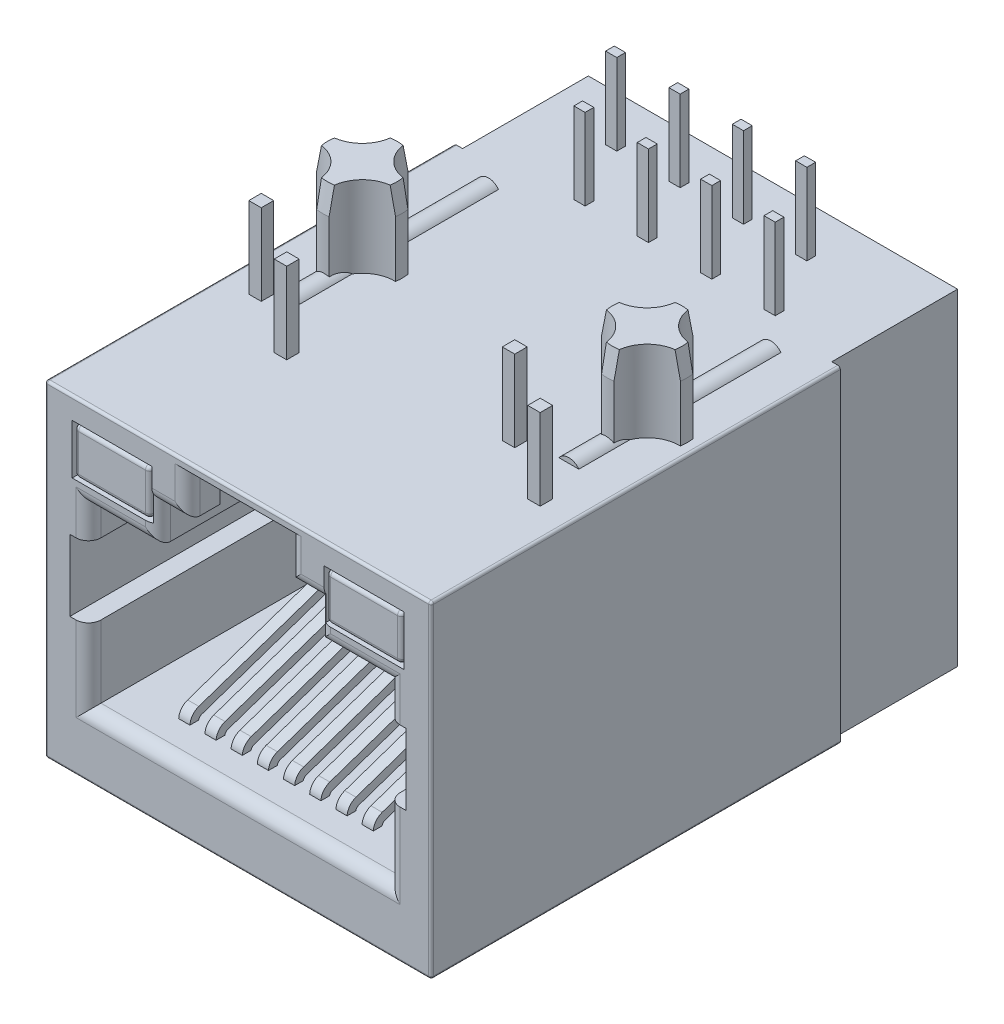
from build123d import *

# Parameters (mm, degrees)
SKETCH1_W            = 15.48
SKETCH1_H            = 13.1
BOSS_EXTRUDE1_DEPTH  = 10.72
SKETCH2_W            = 11.99
SKETCH2_H            = 7.01
CUT_EXTRUDE1_DEPTH   = 12.3
SKETCH4_W            = 6.41
SKETCH4_H            = 3.09
CUT_EXTRUDE3_DEPTH   = 12.3
SKETCH6_W            = 1.18
SKETCH6_H            = 1.61
BOSS_EXTRUDE2_DEPTH  = 1.3
CHAMFER1_SIZE        = 0.2
CHAMFER1_SIZE2       = 1.3
FILLET1_R            = 0.5
BOSS_EXTRUDE3_DEPTH  = 1.3
SKETCH9_W            = 11.99
SKETCH9_H            = 4
BOSS_EXTRUDE4_DEPTH  = 1.3
CHAMFER2_SIZE2       = 0.800078136
CHAMFER2_SIZE        = 1.3
CUT_EXTRUDE4_REACH   = 25.717
SKETCH3_W            = 1.55
SKETCH3_H            = 2.85
SKETCH11_W           = 11.99
SKETCH11_H           = 0.6
CUT_EXTRUDE5_DEPTH   = 1.3
SKETCH10_W           = 0.5
SKETCH10_H           = 3
CUT_EXTRUDE6_DEPTH   = 2.6
LPATTERN1_COUNT      = 8
LPATTERN1_PITCH      = 1.05
BOSS_EXTRUDE5_START  = -3.45
BOSS_EXTRUDE5_DEPTH  = 0.45
LPATTERN2_COUNT      = 8
LPATTERN2_PITCH      = 1.05
FILLET2_R            = 0.53
FILLET3_R            = 0.18
SKETCH13_W           = 3.2
SKETCH13_H           = 2
CUT_EXTRUDE7_DEPTH   = 4
SKETCH14_W           = 3.04
SKETCH14_H           = 1.84
BOSS_EXTRUDE6_DEPTH  = 4
FILLET4_R            = 0.18
FILLET4_OF_MIRROR3_R = 0.18
SKETCH15_R           = 1.6
BOSS_EXTRUDE7_DEPTH  = 3.25
CHAMFER3_SIZE        = 1
CHAMFER3_SIZE2       = 0.2
CUT_EXTRUDE8_REACH   = 23.027
SKETCH16_R           = 1.3
CIRPATTERN1_COUNT    = 4
BOSS_EXTRUDE8_START  = -7.6
BOSS_EXTRUDE8_DEPTH  = 8.1
SKETCH21_W           = 0.34
SKETCH21_H           = 5.04
CUT_EXTRUDE9_DEPTH   = 19.612791301
FILLET5_R            = 0.1
SKETCH22_W           = 0.45
SKETCH22_H           = 0.35
BOSS_EXTRUDE9_DEPTH  = 3.25
LPATTERN3_START      = 6.55
LPATTERN3_OUTLINE_W  = 0.45
LPATTERN3_OUTLINE_H  = 0.35
LPATTERN3_DEPTH      = 3.25
SKETCH23_W           = 0.5
SKETCH23_H           = 0.5
BOSS_EXTRUDE10_DEPTH = 3.25
LPATTERN4_START      = 6.55
LPATTERN4_OUTLINE_W  = 0.5
LPATTERN4_OUTLINE_H  = 0.5
LPATTERN4_DEPTH      = 3.25


# Read off the part's stored shape, not the designer's step: Mirror4, LPattern3, LPattern4
# Some blends are built 0.0001 mm under size
with BuildPart() as part:
    # Sketch1 → Boss-Extrude1 (new, symmetric)
    with BuildSketch(Plane.XY):
        Rectangle(SKETCH1_W, SKETCH1_H)
    extrude(amount=BOSS_EXTRUDE1_DEPTH, both=True)

    # Sketch2 → Cut-Extrude1 (cut)
    with BuildSketch(Plane.XY.offset(10.72)):
        with Locations((0, -0.545)):
            Rectangle(SKETCH2_W, SKETCH2_H)
    extrude(amount=-CUT_EXTRUDE1_DEPTH, mode=Mode.SUBTRACT)

    # Sketch4 → Cut-Extrude3 (cut)
    with BuildSketch(Plane.XY.offset(10.72)):
        with Locations((0, 4.505)):
            Rectangle(SKETCH4_W, SKETCH4_H)
    extrude(amount=-CUT_EXTRUDE3_DEPTH, mode=Mode.SUBTRACT)

    # Sketch6 → Boss-Extrude2 (add)
    with BuildSketch(Plane.XY.offset(10.72)):
        with Locations((2.615, 5.245)):
            Rectangle(SKETCH6_W, SKETCH6_H)
    boss_extrude2 = extrude(amount=-BOSS_EXTRUDE2_DEPTH)

    # Mirror1: Boss-Extrude2 across plane
    add(boss_extrude2.mirror(Plane(origin=(0, 0, 0), x_dir=(0, 0, 1), z_dir=(1, 0, 0))))

    # Chamfer1
    chamfer1_edges = [part.edges().sort_by_distance(p)[0] for p in [
        (0, 6.05, 10.72),
    ]]
    chamfer1_side = [part.faces().sort_by_distance(p)[0] for p in [
        (0, 6.347209369, 10.72),
    ]]
    chamfer(chamfer1_edges, length=CHAMFER1_SIZE, length2=CHAMFER1_SIZE2, reference=chamfer1_side[0])

    # Fillet1
    fillet1_edges = [part.edges().sort_by_distance(p)[0] for p in [
        (5.995, -0.545, 10.72),
        (4.6, 2.96, 10.72),
        (-5.995, -0.545, 10.72),
        (0, -4.05, 10.72),
        (-4.6, 2.96, 10.72),
        (3.205, 3.7, 10.72),
        (2.025, 5.345, 10.72),
        (2.615, 4.44, 10.72),
        (-3.205, 3.7, 10.72),
        (-2.025, 5.345, 10.72),
        (-2.615, 4.44, 10.72),
    ]]
    fillet(fillet1_edges, radius=FILLET1_R)

    # Sketch7 → Boss-Extrude3 (add)
    with BuildSketch(Plane.XY.offset(-1.58)):
        Polygon((-5.995, 2.96), (-2.03, 2.96), (-2.03, 6.05), (2.03, 6.05), (2.03, 2.96), (5.995, 2.96), (5.995, -4.05), (-5.995, -4.05), align=None)
    extrude(amount=BOSS_EXTRUDE3_DEPTH)

    # Sketch9 → Boss-Extrude4 (add)
    with BuildSketch(Plane.XY.offset(-0.28)):
        with Locations((0, -1.45)):
            Rectangle(SKETCH9_W, SKETCH9_H)
    extrude(amount=BOSS_EXTRUDE4_DEPTH)

    # Chamfer2
    chamfer2_edges = [part.edges().sort_by_distance(p)[0] for p in [
        (0, 0.55, 1.02),
    ]]
    chamfer2_side = [part.faces().sort_by_distance(p)[0] for p in [
        (0, 0.55, 1.003998437),
    ]]
    chamfer(chamfer2_edges, length=CHAMFER2_SIZE - 0.0001, length2=CHAMFER2_SIZE2 - 0.0001, reference=chamfer2_side[0])  # a hair under: the kernel refuses the full size

    # Cut-Extrude4: up to this face of the body (flat: up to its plane)
    cut_extrude4_end = Plane(part.part.faces().sort_by_distance((-2.6175, 4.505, -1.58))[0])
    # Sketch3 → Cut-Extrude4 (cut, up to the picked face)
    with BuildSketch(Plane.XY.offset(10.72), mode=Mode.PRIVATE) as cut_extrude4_sk1:
        with Locations((-5.965, 0.265)):
            Rectangle(SKETCH3_W, SKETCH3_H)
    cut_extrude4_tool1 = split(extrude(cut_extrude4_sk1.sketch, amount=-CUT_EXTRUDE4_REACH, mode=Mode.PRIVATE), bisect_by=cut_extrude4_end, keep=Keep.BOTH, mode=Mode.PRIVATE)
    cut_extrude4 = cut_extrude4_tool1.solids().sort_by(Axis((-5.965, 0.265, 10.72), (0, 0, -1)))[0]
    add(cut_extrude4, mode=Mode.SUBTRACT)

    # Mirror2: Cut-Extrude4 across plane
    add(cut_extrude4.mirror(Plane(origin=(0, 0, 0), x_dir=(0, 0, 1), z_dir=(1, 0, 0))), mode=Mode.SUBTRACT)

    # Sketch11 → Cut-Extrude5 (cut)
    with BuildSketch(Plane.XY.offset(-0.28)):
        with Locations((0, -3.75)):
            Rectangle(SKETCH11_W, SKETCH11_H)
    extrude(amount=-CUT_EXTRUDE5_DEPTH, mode=Mode.SUBTRACT)

    # Sketch10 → Cut-Extrude6 (cut)
    with BuildSketch(Plane.XY.offset(1.02)):
        with Locations((-3.675, -1.95)):
            Rectangle(SKETCH10_W, SKETCH10_H)
    cut_extrude6 = extrude(amount=-CUT_EXTRUDE6_DEPTH, mode=Mode.SUBTRACT)

    # LPattern1: Cut-Extrude6 ×8
    with Locations(*[(i * LPATTERN1_PITCH, 0, 0) for i in range(1, LPATTERN1_COUNT)]):
        add(cut_extrude6, mode=Mode.SUBTRACT)

    # Sketch12 → Boss-Extrude5 (add)
    with BuildSketch(Plane(origin=(0, 0, 0), x_dir=(0, 0, -1), z_dir=(1, 0, 0)).offset(BOSS_EXTRUDE5_START)):
        Polygon((-9.2, -3.7), (-0.211652153, -0.624353243), (-0.098338851, -0.9555029), (-8.85, -3.950159837), (-8.85, -4.05), (-9.2, -4.05), align=None)
    boss_extrude5 = extrude(amount=-BOSS_EXTRUDE5_DEPTH)

    # LPattern2: Boss-Extrude5 ×8
    with Locations(*[(i * LPATTERN2_PITCH, 0, 0) for i in range(1, LPATTERN2_COUNT)]):
        add(boss_extrude5)

    # Fillet2
    # the kernel refuses this fillet: 0.53 mm, written as the material it takes off along each edge
    with BuildSketch(Plane(origin=(-2.50296633, -3.7, 9.2), x_dir=(0, -1, 0), z_dir=(-1, 0, 0))) as fillet2_piece_1_section:
        with BuildLine():
            CenterArc((FILLET2_R * 0.71474239226, -FILLET2_R), FILLET2_R, 90, 71.11)
            Line((-FILLET2_R * 0.231399486412, -FILLET2_R * 0.67624770978), (0, 0))
            Line((0, 0), (FILLET2_R * 0.71474239226, 0))
        make_face()
    fillet2_piece_1 = extrude(amount=2.344067339, mode=Mode.PRIVATE)
    fillet2_piece_1 = split(fillet2_piece_1, bisect_by=Plane(origin=(-3.675, -4.05, 9.120532558), z_dir=(0, 1, 0)), keep=Keep.TOP, mode=Mode.PRIVATE)
    add(fillet2_piece_1, mode=Mode.SUBTRACT)
    with BuildSketch(Plane(origin=(4.84703367, -3.7, 9.2), x_dir=(0, -1, 0), z_dir=(-1, 0, 0))) as fillet2_piece_2_section:
        with BuildLine():
            CenterArc((FILLET2_R * 0.71474239226, -FILLET2_R), FILLET2_R, 90, 71.11)
            Line((-FILLET2_R * 0.231399486412, -FILLET2_R * 0.67624770978), (0, 0))
            Line((0, 0), (FILLET2_R * 0.71474239226, 0))
        make_face()
    fillet2_piece_2 = extrude(amount=2.344067339, mode=Mode.PRIVATE)
    fillet2_piece_2 = split(fillet2_piece_2, bisect_by=Plane(origin=(3.675, -4.05, 9.120532558), z_dir=(0, 1, 0)), keep=Keep.TOP, mode=Mode.PRIVATE)
    add(fillet2_piece_2, mode=Mode.SUBTRACT)
    with BuildSketch(Plane(origin=(3.79703367, -3.7, 9.2), x_dir=(0, -1, 0), z_dir=(-1, 0, 0))) as fillet2_piece_3_section:
        with BuildLine():
            CenterArc((FILLET2_R * 0.71474239226, -FILLET2_R), FILLET2_R, 90, 71.11)
            Line((-FILLET2_R * 0.231399486412, -FILLET2_R * 0.67624770978), (0, 0))
            Line((0, 0), (FILLET2_R * 0.71474239226, 0))
        make_face()
    fillet2_piece_3 = extrude(amount=2.344067339, mode=Mode.PRIVATE)
    fillet2_piece_3 = split(fillet2_piece_3, bisect_by=Plane(origin=(2.625, -4.05, 9.120532558), z_dir=(0, 1, 0)), keep=Keep.TOP, mode=Mode.PRIVATE)
    add(fillet2_piece_3, mode=Mode.SUBTRACT)
    with BuildSketch(Plane(origin=(2.74703367, -3.7, 9.2), x_dir=(0, -1, 0), z_dir=(-1, 0, 0))) as fillet2_piece_4_section:
        with BuildLine():
            CenterArc((FILLET2_R * 0.71474239226, -FILLET2_R), FILLET2_R, 90, 71.11)
            Line((-FILLET2_R * 0.231399486412, -FILLET2_R * 0.67624770978), (0, 0))
            Line((0, 0), (FILLET2_R * 0.71474239226, 0))
        make_face()
    fillet2_piece_4 = extrude(amount=2.344067339, mode=Mode.PRIVATE)
    fillet2_piece_4 = split(fillet2_piece_4, bisect_by=Plane(origin=(1.575, -4.05, 9.120532558), z_dir=(0, 1, 0)), keep=Keep.TOP, mode=Mode.PRIVATE)
    add(fillet2_piece_4, mode=Mode.SUBTRACT)
    with BuildSketch(Plane(origin=(1.69703367, -3.7, 9.2), x_dir=(0, -1, 0), z_dir=(-1, 0, 0))) as fillet2_piece_5_section:
        with BuildLine():
            CenterArc((FILLET2_R * 0.71474239226, -FILLET2_R), FILLET2_R, 90, 71.11)
            Line((-FILLET2_R * 0.231399486412, -FILLET2_R * 0.67624770978), (0, 0))
            Line((0, 0), (FILLET2_R * 0.71474239226, 0))
        make_face()
    fillet2_piece_5 = extrude(amount=2.344067339, mode=Mode.PRIVATE)
    fillet2_piece_5 = split(fillet2_piece_5, bisect_by=Plane(origin=(0.525, -4.05, 9.120532558), z_dir=(0, 1, 0)), keep=Keep.TOP, mode=Mode.PRIVATE)
    add(fillet2_piece_5, mode=Mode.SUBTRACT)
    with BuildSketch(Plane(origin=(0.64703367, -3.7, 9.2), x_dir=(0, -1, 0), z_dir=(-1, 0, 0))) as fillet2_piece_6_section:
        with BuildLine():
            CenterArc((FILLET2_R * 0.71474239226, -FILLET2_R), FILLET2_R, 90, 71.11)
            Line((-FILLET2_R * 0.231399486412, -FILLET2_R * 0.67624770978), (0, 0))
            Line((0, 0), (FILLET2_R * 0.71474239226, 0))
        make_face()
    fillet2_piece_6 = extrude(amount=2.344067339, mode=Mode.PRIVATE)
    fillet2_piece_6 = split(fillet2_piece_6, bisect_by=Plane(origin=(-0.525, -4.05, 9.120532558), z_dir=(0, 1, 0)), keep=Keep.TOP, mode=Mode.PRIVATE)
    add(fillet2_piece_6, mode=Mode.SUBTRACT)
    with BuildSketch(Plane(origin=(-0.40296633, -3.7, 9.2), x_dir=(0, -1, 0), z_dir=(-1, 0, 0))) as fillet2_piece_7_section:
        with BuildLine():
            CenterArc((FILLET2_R * 0.71474239226, -FILLET2_R), FILLET2_R, 90, 71.11)
            Line((-FILLET2_R * 0.231399486412, -FILLET2_R * 0.67624770978), (0, 0))
            Line((0, 0), (FILLET2_R * 0.71474239226, 0))
        make_face()
    fillet2_piece_7 = extrude(amount=2.344067339, mode=Mode.PRIVATE)
    fillet2_piece_7 = split(fillet2_piece_7, bisect_by=Plane(origin=(-1.575, -4.05, 9.120532558), z_dir=(0, 1, 0)), keep=Keep.TOP, mode=Mode.PRIVATE)
    add(fillet2_piece_7, mode=Mode.SUBTRACT)
    with BuildSketch(Plane(origin=(-1.45296633, -3.7, 9.2), x_dir=(0, -1, 0), z_dir=(-1, 0, 0))) as fillet2_piece_8_section:
        with BuildLine():
            CenterArc((FILLET2_R * 0.71474239226, -FILLET2_R), FILLET2_R, 90, 71.11)
            Line((-FILLET2_R * 0.231399486412, -FILLET2_R * 0.67624770978), (0, 0))
            Line((0, 0), (FILLET2_R * 0.71474239226, 0))
        make_face()
    fillet2_piece_8 = extrude(amount=2.344067339, mode=Mode.PRIVATE)
    fillet2_piece_8 = split(fillet2_piece_8, bisect_by=Plane(origin=(-2.625, -4.05, 9.120532558), z_dir=(0, 1, 0)), keep=Keep.TOP, mode=Mode.PRIVATE)
    add(fillet2_piece_8, mode=Mode.SUBTRACT)

    # Fillet3
    # the kernel refuses this fillet: 0.18 mm, written as the material it adds along each edge
    with BuildSketch(Plane(origin=(-3.45, -3.950159837, 8.85), x_dir=(0, -1, 0), z_dir=(-1, 0, 0)), Plane(origin=(-2.4, -3.950159837, 8.85), x_dir=(0, -1, 0), z_dir=(-1, 0, 0))) as fillet3_piece_1:
        with BuildLine():
            CenterArc((0.129495279, -0.177540345), FILLET3_R, 99.482749364, 61.627250636)
            Line((-0.040810259, -0.119264933), (-0.04421637, -0.118099424))
            Line((-0.04421637, -0.118099424), (-0.003406111, 0.001165508))
            Line((-0.003406111, 0.001165508), (0, 0.0036))
            ThreePointArc((0, 0.0036), (0.049920081, 0.0036), (0.09924706, 0.003550807))
            Line((0.09924706, 0.003550807), (0.099840163, 0))
        make_face()
    extrude(amount=0.45)
    with BuildSketch(Plane(origin=(3.9, -3.950159837, 8.85), x_dir=(0, 0.32375229022027774, -0.9461418786720758), z_dir=(-1, 0, 0)), Plane(origin=(2.85, -3.950159837, 8.85), x_dir=(0, 0.32375229022027774, -0.9461418786720758), z_dir=(-1, 0, 0)), Plane(origin=(1.8, -3.950159837, 8.85), x_dir=(0, 0.32375229022027774, -0.9461418786720758), z_dir=(-1, 0, 0)), Plane(origin=(0.75, -3.950159837, 8.85), x_dir=(0, 0.32375229022027774, -0.9461418786720758), z_dir=(-1, 0, 0)), Plane(origin=(-0.3, -3.950159837, 8.85), x_dir=(0, 0.32375229022027774, -0.9461418786720758), z_dir=(-1, 0, 0)), Plane(origin=(-1.35, -3.950159837, 8.85), x_dir=(0, 0.32375229022027774, -0.9461418786720758), z_dir=(-1, 0, 0))) as fillet3_piece_2:
        with BuildLine():
            CenterArc((0.126053962, 0.18), FILLET3_R, 208.372749364, 61.627250636)
            Line((-0.032323481, 0.094462959), (-0.03549103, 0.092752218))
            ThreePointArc((-0.03549103, 0.092752218), (-0.019567851, 0.046065971), (-0.003406111, -0.001165508))
            Line((-0.003406111, -0.001165508), (0, -0.0036))
            Line((0, -0.0036), (0.126053962, -0.0036))
            Line((0.126053962, -0.0036), (0.126053962, 0))
        make_face()
    extrude(amount=0.45)

    # Sketch13 → Cut-Extrude7 (cut)
    with BuildSketch(Plane.XY.offset(10.72)):
        with Locations((5.05, 4.69)):
            Rectangle(SKETCH13_W, SKETCH13_H)
    cut_extrude7 = extrude(amount=-CUT_EXTRUDE7_DEPTH, mode=Mode.SUBTRACT)

    # Sketch14 → Boss-Extrude6 (add)
    with BuildSketch(Plane.XY.offset(6.72)):
        with Locations((5.05, 4.69)):
            Rectangle(SKETCH14_W, SKETCH14_H)
    boss_extrude6 = extrude(amount=BOSS_EXTRUDE6_DEPTH)

    # Fillet4
    fillet4_edges = [part.edges().sort_by_distance(p)[0] for p in [
        (6.57, 3.77, 8.72),
        (6.57, 5.61, 8.72),
        (3.53, 5.61, 8.72),
        (3.53, 3.77, 8.72),
        (5.05, 3.77, 10.72),
        (6.57, 4.69, 10.72),
        (5.05, 5.61, 10.72),
        (3.53, 4.69, 10.72),
    ]]
    fillet(fillet4_edges, radius=FILLET4_R)

    # Mirror3: Cut-Extrude7, Boss-Extrude6 across plane
    add(cut_extrude7.mirror(Plane(origin=(0, 0, 0), x_dir=(0, 0, 1), z_dir=(1, 0, 0))), mode=Mode.SUBTRACT)
    add(boss_extrude6.mirror(Plane(origin=(0, 0, 0), x_dir=(0, 0, 1), z_dir=(1, 0, 0))))

    # Fillet4 of Mirror3
    fillet4_of_mirror3_edges = [part.edges().sort_by_distance(p)[0] for p in [
        (-6.57, 3.77, 8.72),
        (-6.57, 5.61, 8.72),
        (-3.53, 5.61, 8.72),
        (-3.53, 3.77, 8.72),
        (-5.05, 3.77, 10.72),
        (-6.57, 4.69, 10.72),
        (-5.05, 5.61, 10.72),
        (-3.53, 4.69, 10.72),
    ]]
    fillet(fillet4_of_mirror3_edges, radius=FILLET4_OF_MIRROR3_R)

    # Sketch15 → Boss-Extrude7 (add)
    with BuildSketch(Plane(origin=(0, 6.55, 0), x_dir=(1, 0, 0), z_dir=(0, 1, 0))):
        with Locations(Location((5.71, -0.03, 0), (0, 0, 90))):
            Circle(SKETCH15_R)
    extrude(amount=BOSS_EXTRUDE7_DEPTH)

    # Chamfer3
    chamfer3_edges = [part.edges().sort_by_distance(p)[0] for p in [
        (5.71, 9.8, 1.63),
    ]]
    chamfer3_side = [part.faces().sort_by_distance(p)[0] for p in [
        (5.71, 8.175, 1.63),
    ]]
    chamfer(chamfer3_edges, length=CHAMFER3_SIZE, length2=CHAMFER3_SIZE2, reference=chamfer3_side[0])

    # Cut-Extrude8: up to this face of the body (flat: up to its plane)
    cut_extrude8_end = Plane(part.part.faces().sort_by_distance((-0.141802458, 6.55, -0.000745022))[0])
    # Sketch16 → Cut-Extrude8 (cut, up to the picked face)
    with BuildSketch(Plane(origin=(0, 9.8, 0), x_dir=(1, 0, 0), z_dir=(0, 1, 0)), mode=Mode.PRIVATE) as cut_extrude8_sk1:
        with Locations((7.258563851, 1.518563851)):
            Circle(SKETCH16_R)
    cut_extrude8_tool1 = split(extrude(cut_extrude8_sk1.sketch, amount=-CUT_EXTRUDE8_REACH, mode=Mode.PRIVATE), bisect_by=cut_extrude8_end, keep=Keep.BOTH, mode=Mode.PRIVATE)
    cut_extrude8 = cut_extrude8_tool1.solids().sort_by(Axis((7.258564, 9.8, -1.518564), (0, -1, 0)))[0]
    add(cut_extrude8, mode=Mode.SUBTRACT)

    # CirPattern1: Cut-Extrude8 ×4 about axis
    cirpattern1_axis = Axis((5.71, 0, 0.03), (0, 1, 0))
    for i in range(1, CIRPATTERN1_COUNT):
        add(cut_extrude8.rotate(cirpattern1_axis, i * 360 / CIRPATTERN1_COUNT), mode=Mode.SUBTRACT)

    # Sketch18 → Boss-Extrude8 (add)
    with BuildSketch(Plane.XY.offset(10.72).offset(BOSS_EXTRUDE8_START)):
        with BuildLine():
            Line((5.260026311, 6.55), (6.060026311, 6.55))
            ThreePointArc((6.060026311, 6.55), (5.660026311, 6.75), (5.260026311, 6.55))
        make_face()
    extrude(amount=-BOSS_EXTRUDE8_DEPTH)

    # Sketch21 → Cut-Extrude9 (cut, through all)
    with BuildSketch(Plane(origin=(0, 6.55, 0), x_dir=(1, 0, 0), z_dir=(0, 1, 0))):
        with Locations((7.57, 8.2)):
            Rectangle(SKETCH21_W, SKETCH21_H)
    extrude(amount=-CUT_EXTRUDE9_DEPTH, mode=Mode.SUBTRACT)

    # Mirror4
    split(bisect_by=Plane(origin=(0, 0, 0), x_dir=(0, 0, 1), z_dir=(1, 0, 0)), keep=Keep.TOP)

    # Mirror4 2: part across plane


with BuildPart() as part_1:
    add(part.part)
    add(part.part.mirror(Plane(origin=(0, 0, 0), x_dir=(0, 0, 1), z_dir=(1, 0, 0))))

    # Fillet5
    fillet5_edges = [part_1.edges().sort_by_distance(p)[0] for p in [
        (-7.74, 0, 10.72),
        (0, -6.55, 10.72),
        (7.74, 0, 10.72),
        (0, 6.55, 10.72),
        (7.74, -6.55, 2.52),
        (-7.74, -6.55, 2.52),
        (-7.74, 6.55, 2.52),
        (7.74, 6.55, 2.52),
    ]]
    fillet(fillet5_edges, radius=FILLET5_R)

    # Sketch22 → Boss-Extrude9 (add)
    with BuildSketch(Plane(origin=(0, 6.55, 0), x_dir=(1, 0, 0), z_dir=(0, 1, 0))):
        with Locations((4.445, 6.315)):
            Rectangle(SKETCH22_W, SKETCH22_H)
    extrude(amount=BOSS_EXTRUDE9_DEPTH)

    # LPattern3 outline → LPattern3 (add)
    with BuildSketch(Plane(origin=(0, 0, 0), x_dir=(1, 0, 0), z_dir=(0, 1, 0)).offset(LPATTERN3_START)):
        with Locations((1.905, 6.315)):
            Rectangle(LPATTERN3_OUTLINE_W, LPATTERN3_OUTLINE_H)
        with Locations((-0.635, 6.315)):
            Rectangle(LPATTERN3_OUTLINE_W, LPATTERN3_OUTLINE_H)
        with Locations((-3.175, 6.315)):
            Rectangle(LPATTERN3_OUTLINE_W, LPATTERN3_OUTLINE_H)
        with Locations((3.175, 8.855)):
            Rectangle(LPATTERN3_OUTLINE_W, LPATTERN3_OUTLINE_H)
        with Locations((0.635, 8.855)):
            Rectangle(LPATTERN3_OUTLINE_W, LPATTERN3_OUTLINE_H)
        with Locations((-1.905, 8.855)):
            Rectangle(LPATTERN3_OUTLINE_W, LPATTERN3_OUTLINE_H)
        with Locations((-4.445, 8.855)):
            Rectangle(LPATTERN3_OUTLINE_W, LPATTERN3_OUTLINE_H)
    extrude(amount=LPATTERN3_DEPTH)

    # Sketch23 → Boss-Extrude10 (add)
    with BuildSketch(Plane(origin=(0, 6.55, 0), x_dir=(1, 0, 0), z_dir=(0, 1, 0))):
        with Locations((6.32, -4.93)):
            Rectangle(SKETCH23_W, SKETCH23_H)
    extrude(amount=BOSS_EXTRUDE10_DEPTH)

    # LPattern4 outline → LPattern4 (add)
    with BuildSketch(Plane(origin=(0, 0, 0), x_dir=(1, 0, 0), z_dir=(0, 1, 0)).offset(LPATTERN4_START)):
        with Locations((3.78, -3.41)):
            Rectangle(LPATTERN4_OUTLINE_W, LPATTERN4_OUTLINE_H)
        with Locations((-3.84, -4.93)):
            Rectangle(LPATTERN4_OUTLINE_W, LPATTERN4_OUTLINE_H)
        with Locations((-6.38, -3.41)):
            Rectangle(LPATTERN4_OUTLINE_W, LPATTERN4_OUTLINE_H)
    extrude(amount=LPATTERN4_DEPTH)


solid = part_1.part
